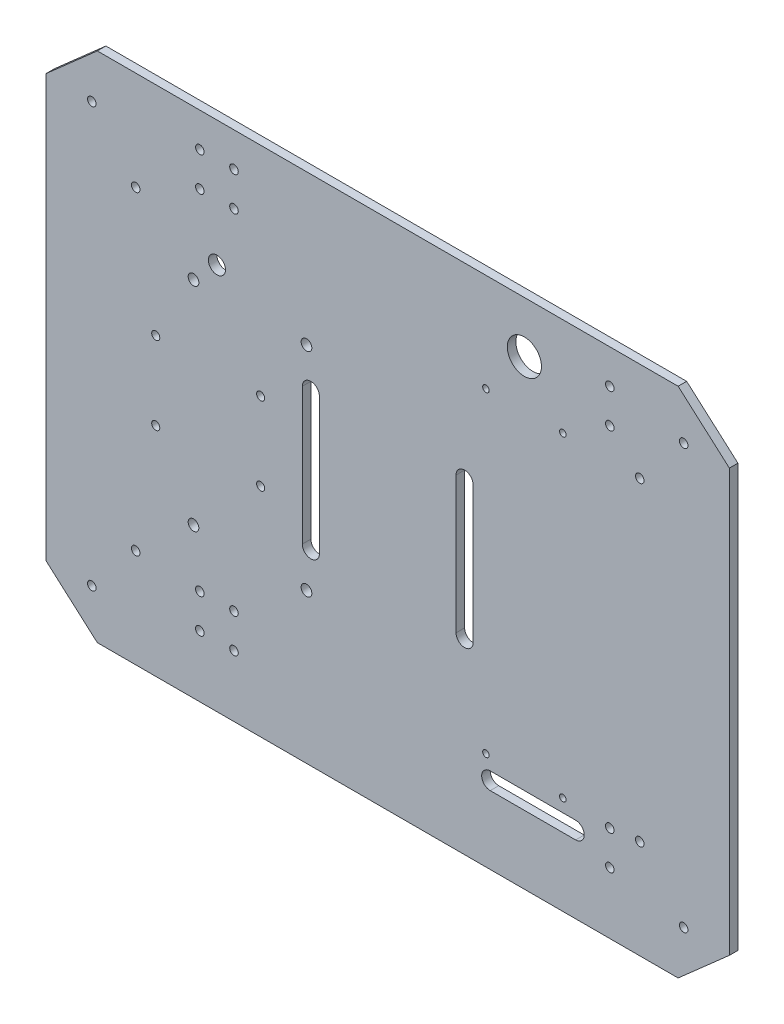
from build123d import *

# Parameters (mm, degrees)
BOSS_EXTRUDE1_DEPTH = 3.175
SKETCH2_R           = 1.213592974
CUT_EXTRUDE1_DEPTH  = 159.781746826
SKETCH5_R           = 3.175
SKETCH5_R_2         = 6.35
SKETCH5_R_3         = 1.5875
SKETCH5_R_4         = 1.984375
SKETCH5_R_5         = 1.5
CUT_EXTRUDE2_DEPTH  = 159.781746826
SKETCH7_R           = 1.5875
CUT_EXTRUDE3_DEPTH  = 159.781746826


with BuildPart() as part:
    # Sketch1 → Boss-Extrude1 (new body)
    with BuildSketch(Plane.XY):
        Polygon((127, -78.437520737), (127, 78.437520737), (107.95, 95.25), (-107.95, 95.25), (-127, 78.437520737), (-127, -78.437520737), (-107.95, -95.25), (107.95, -95.25), align=None)
    extrude(amount=BOSS_EXTRUDE1_DEPTH)

    # Sketch2 → Cut-Extrude1 (cut, through all)
    with BuildSketch(Plane.XY.offset(3.175)):
        with Locations((36.5125, 58.7375)):
            Circle(SKETCH2_R)
        with Locations((36.5125, -58.7375)):
            Circle(SKETCH2_R)
        with Locations((65.0875, -58.7375)):
            Circle(SKETCH2_R)
        with Locations((65.0875, 58.7375)):
            Circle(SKETCH2_R)
    extrude(amount=-CUT_EXTRUDE1_DEPTH, mode=Mode.SUBTRACT)

    # Sketch5 → Cut-Extrude2 (cut, through all)
    with BuildSketch(Plane(origin=(0, 0, 0), x_dir=(-1, 0, 0), z_dir=(0, 0, -1))):
        with BuildLine():
            ThreePointArc((31.75, 25.4), (28.575, 28.575), (25.4, 25.4))
            Line((25.4, 25.4), (25.4, -25.4))
            ThreePointArc((25.4, -25.4), (28.575, -28.575), (31.75, -25.4))
            Line((31.75, -25.4), (31.75, 25.4))
        make_face()
        with BuildLine():
            ThreePointArc((-25.4, 25.4), (-28.575, 28.575), (-31.75, 25.4))
            Line((-31.75, 25.4), (-31.75, -25.4))
            ThreePointArc((-31.75, -25.4), (-28.575, -28.575), (-25.4, -25.4))
            Line((-25.4, -25.4), (-25.4, 25.4))
        make_face()
        with BuildLine():
            Line((-38.1, -63.5), (-69.85, -63.5))
            ThreePointArc((-69.85, -63.5), (-73.025, -66.675), (-69.85, -69.85))
            Line((-69.85, -69.85), (-38.1, -69.85))
            ThreePointArc((-38.1, -69.85), (-34.925, -66.675), (-38.1, -63.5))
        make_face()
        with Locations((63.5, 48.58004)):
            Circle(SKETCH5_R)
        with Locations((-50.8, 76.2)):
            Circle(SKETCH5_R_2)
        with Locations((57.15, 69.85)):
            Circle(SKETCH5_R_3)
        with Locations((57.15, 82.55)):
            Circle(SKETCH5_R_3)
        with Locations((57.15, -72.39)):
            Circle(SKETCH5_R_3)
        with Locations((57.15, -59.69)):
            Circle(SKETCH5_R_3)
        with Locations((69.85, -72.39)):
            Circle(SKETCH5_R_3)
        with Locations((69.85, -59.69)):
            Circle(SKETCH5_R_3)
        with Locations((69.85, 82.55)):
            Circle(SKETCH5_R_3)
        with Locations((69.85, 69.85)):
            Circle(SKETCH5_R_3)
        with Locations((30.2006, 39.49954)):
            Circle(SKETCH5_R_4)
        with Locations((72.1995, 39.49954)):
            Circle(SKETCH5_R_4)
        with Locations((30.2006, -39.49954)):
            Circle(SKETCH5_R_4)
        with Locations((72.1995, -39.49954)):
            Circle(SKETCH5_R_4)
        with Locations((-82.55, -59.69)):
            Circle(SKETCH5_R_3)
        with Locations((-82.55, -72.39)):
            Circle(SKETCH5_R_3)
        with Locations((-82.55, 82.55)):
            Circle(SKETCH5_R_3)
        with Locations((-82.55, 69.85)):
            Circle(SKETCH5_R_3)
        with Locations((47.236908857, 14.5)):
            Circle(SKETCH5_R_5)
        with Locations((47.236908857, -14.5)):
            Circle(SKETCH5_R_5)
        with Locations((86.236908857, -14.5)):
            Circle(SKETCH5_R_5)
        with Locations((86.236908857, 14.5)):
            Circle(SKETCH5_R_5)
    extrude(amount=-CUT_EXTRUDE2_DEPTH, mode=Mode.SUBTRACT)

    # Sketch7 → Cut-Extrude3 (cut, through all)
    with BuildSketch(Plane.XY.offset(3.175)):
        with Locations((-110.011443501, 77.949040098)):
            Circle(SKETCH7_R)
        with Locations((-93.684638215, 58.491511242)):
            Circle(SKETCH7_R)
        with Locations((110.011443501, 77.949040098)):
            Circle(SKETCH7_R)
        with Locations((93.684638215, 58.491511242)):
            Circle(SKETCH7_R)
        with Locations((110.011443501, -77.949040098)):
            Circle(SKETCH7_R)
        with Locations((93.684638215, -58.491511242)):
            Circle(SKETCH7_R)
        with Locations((-110.011443501, -77.949040098)):
            Circle(SKETCH7_R)
        with Locations((-93.684638215, -58.491511242)):
            Circle(SKETCH7_R)
    extrude(amount=-CUT_EXTRUDE3_DEPTH, mode=Mode.SUBTRACT)


solid = part.part
